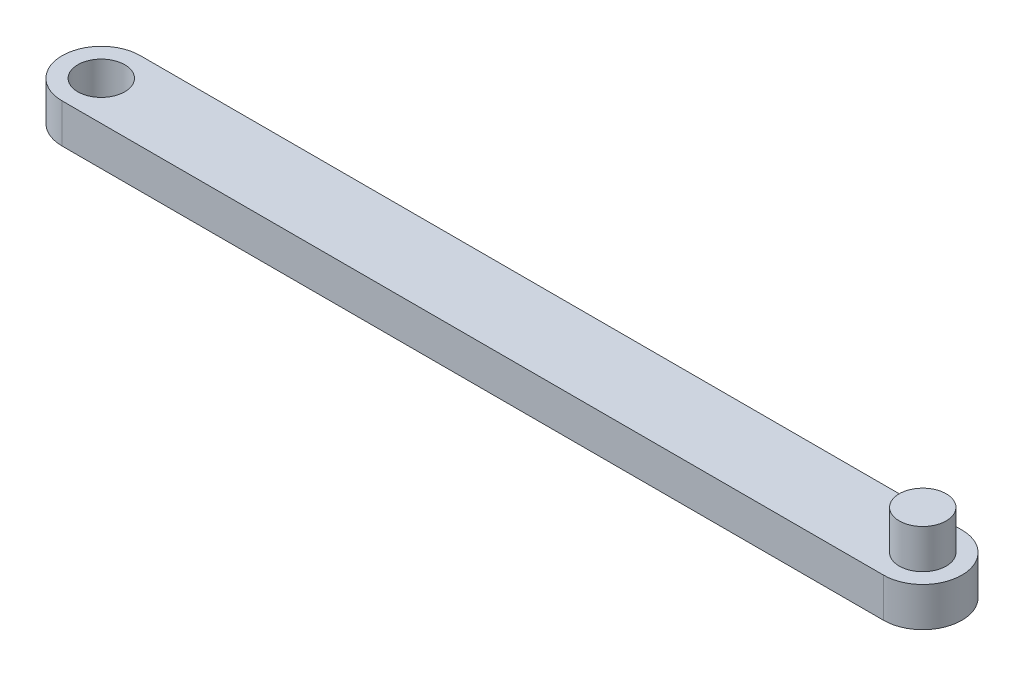
from build123d import *

# Parameters (mm, degrees)
SKETCH_1_R      = 3
EXTRUDE_1_DEPTH = 5
SKETCH_2_R      = 3
EXTRUDE_2_DEPTH = 5


with BuildPart() as part:
    # 草图1 → 凸台-拉伸1 (new body)
    with BuildSketch(Plane(origin=(0, 0, 0), x_dir=(1, 0, 0), z_dir=(0, 1, 0))):
        with BuildLine():
            Line((0, 0), (104.91, 0))
            ThreePointArc((104.91, 0), (109.91, -5), (104.91, -10))
            Line((104.91, -10), (0, -10))
            ThreePointArc((0, -10), (-5, -5), (0, 0))
        make_face()
        with Locations((0, -5)):
            Circle(SKETCH_1_R, mode=Mode.SUBTRACT)
    extrude(amount=EXTRUDE_1_DEPTH)

    # 草图2 → 凸台-拉伸2 (add)
    with BuildSketch(Plane(origin=(0, 5, 0), x_dir=(1, 0, 0), z_dir=(0, 1, 0))):
        with Locations((104.91, -5)):
            Circle(SKETCH_2_R)
    extrude(amount=EXTRUDE_2_DEPTH)


solid = part.part
